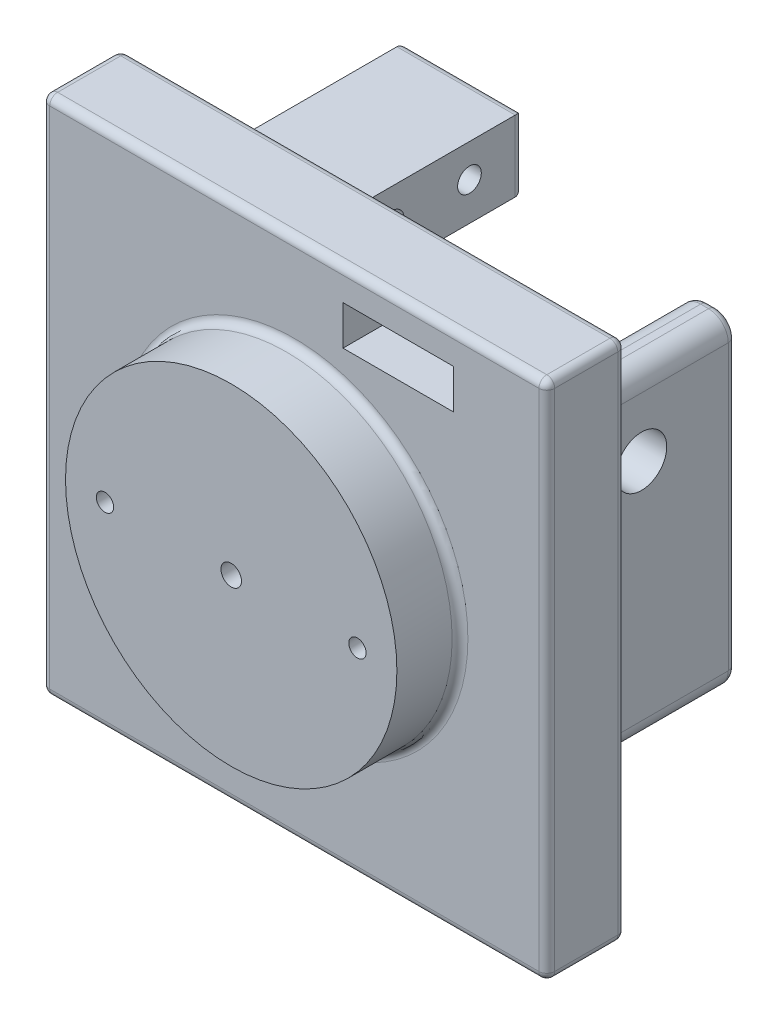
from build123d import *

# Parameters (mm, degrees)
SKETCH1_R               = 21
BOSS_EXTRUDE1_DEPTH     = 8
CUT_EXTRUDE1_DEPTH      = 31.757112998
CUT_EXTRUDE1_DEPTH_BACK = 31.757112998
SKETCH2_R               = 1.3
SKETCH4_R               = 1.1
CUT_EXTRUDE2_DEPTH      = 10
SKETCH5_R               = 1.1
CUT_EXTRUDE3_DEPTH      = 10
SKETCH11_W              = 64
SKETCH11_H              = 66
BOSS_EXTRUDE3_DEPTH     = 10
CUT_EXTRUDE8_START      = -10
SKETCH17_R              = 1.3
CUT_EXTRUDE8_DEPTH      = 10
SKETCH12_W              = 15
SKETCH12_H              = 9
BOSS_EXTRUDE4_DEPTH     = 22
SKETCH13_R              = 1.5
CUT_EXTRUDE4_DEPTH      = 21
SKETCH14_W              = 6
SKETCH14_H              = 41
BOSS_EXTRUDE5_DEPTH     = 22
SKETCH15_R              = 3.2
CUT_EXTRUDE6_DEPTH      = 22
FILLET12_R              = 1
FILLET13_R              = 1
FILLET14_R              = 2.5
SKETCH16_W              = 14
SKETCH16_H              = 5
CUT_EXTRUDE7_DEPTH      = 22
FILLET15_R              = 2.5
SKETCH18_R              = 2.75
CUT_EXTRUDE9_DEPTH      = 3.1


# Some blends are built 0.0001 mm under size
with BuildPart() as part:
    # Sketch1 → Boss-Extrude1 (new body)
    with BuildSketch(Plane.XY):
        Circle(SKETCH1_R)
    extrude(amount=BOSS_EXTRUDE1_DEPTH)

    # Sketch2 → Cut-Extrude1 (cut, two sides: drawn at the far end of the back side and taken through both)
    with BuildSketch(Plane(origin=(0, 0, 0), x_dir=(-1, 0, 0), z_dir=(0, 0, -1)).offset(-CUT_EXTRUDE1_DEPTH_BACK)):
        Circle(SKETCH2_R)
    extrude(amount=CUT_EXTRUDE1_DEPTH + CUT_EXTRUDE1_DEPTH_BACK, mode=Mode.SUBTRACT)

    # Sketch4 → Cut-Extrude2 (cut)
    with BuildSketch(Plane(origin=(0, 0, 0), x_dir=(-1, 0, 0), z_dir=(0, 0, -1))):
        with Locations((16, 0)):
            Circle(SKETCH4_R)
    extrude(amount=-CUT_EXTRUDE2_DEPTH, mode=Mode.SUBTRACT)

    # Sketch5 → Cut-Extrude3 (cut)
    with BuildSketch(Plane(origin=(0, 0, 0), x_dir=(-1, 0, 0), z_dir=(0, 0, -1))):
        with Locations((-16, 0)):
            Circle(SKETCH5_R)
    extrude(amount=-CUT_EXTRUDE3_DEPTH, mode=Mode.SUBTRACT)

    # Sketch11 → Boss-Extrude3 (add)
    with BuildSketch(Plane(origin=(0, 0, 0), x_dir=(-1, 0, 0), z_dir=(0, 0, -1))):
        Rectangle(SKETCH11_W, SKETCH11_H)
    extrude(amount=BOSS_EXTRUDE3_DEPTH)

    # Sketch17 → Cut-Extrude8 (cut)
    with BuildSketch(Plane.XY.offset(CUT_EXTRUDE8_START)):
        with Locations(Location((0, 0, 0), (0, 0, 180))):
            Circle(SKETCH17_R)
    extrude(amount=CUT_EXTRUDE8_DEPTH, mode=Mode.SUBTRACT)

    # Sketch12 → Boss-Extrude4 (add)
    with BuildSketch(Plane(origin=(0, 0, -10), x_dir=(-1, 0, 0), z_dir=(0, 0, -1))):
        with Locations((10.5, -25)):
            Rectangle(SKETCH12_W, SKETCH12_H)
        with Locations((10.5, 25)):
            Rectangle(SKETCH12_W, SKETCH12_H)
    extrude(amount=BOSS_EXTRUDE4_DEPTH)

    # Sketch13 → Cut-Extrude4 (cut)
    with BuildSketch(Plane.ZY.offset(18)):
        with Locations((-25.2, -25.3)):
            Circle(SKETCH13_R)
        with Locations((-15.4, -25.3)):
            Circle(SKETCH13_R)
        with Locations((-25.2, 25.3)):
            Circle(SKETCH13_R)
        with Locations((-15.4, 25.3)):
            Circle(SKETCH13_R)
    extrude(amount=-CUT_EXTRUDE4_DEPTH, mode=Mode.SUBTRACT)

    # Sketch14 → Boss-Extrude5 (add)
    with BuildSketch(Plane(origin=(0, 0, -10), x_dir=(-1, 0, 0), z_dir=(0, 0, -1))):
        with Locations((-21, 0)):
            Rectangle(SKETCH14_W, SKETCH14_H)
    extrude(amount=BOSS_EXTRUDE5_DEPTH)

    # Sketch15 → Cut-Extrude6 (cut)
    with BuildSketch(Plane.ZY.offset(-18)):
        with Locations(Location((-20, 10.5, 0), (0, 0, 270))):
            Circle(SKETCH15_R)
    extrude(amount=-CUT_EXTRUDE6_DEPTH, mode=Mode.SUBTRACT)

    # Fillet12
    fillet12_edges = [part.edges().sort_by_distance(p)[0] for p in [
        (-21, 0, 0),
        (-32, 0, 0),
        (-32, -33, -5),
        (0, 33, 0),
        (-32, 33, -5),
        (32, 0, 0),
        (32, 33, -5),
        (0, -33, 0),
        (32, -33, -5),
        (-32, 0, -10),
        (0, 33, -10),
        (32, 0, -10),
        (0, -33, -10),
    ]]
    fillet(fillet12_edges, radius=FILLET12_R)

    # Fillet13
    fillet13_edges = [part.edges().sort_by_distance(p)[0] for p in [
        (-3, -25, -32),
        (-10.5, -29.5, -32),
        (-18, -25, -32),
        (-10.5, -20.5, -32),
        (-3, 25, -32),
        (-10.5, 20.5, -32),
        (-18, 25, -32),
        (-10.5, 29.5, -32),
        (18, 0, -32),
        (21, 20.5, -32),
        (24, 0, -32),
        (21, -20.5, -32),
    ]]
    fillet(fillet13_edges, radius=FILLET13_R)

    # Fillet14
    # the kernel refuses this fillet: 2.5 mm, written as the material it takes off along each edge
    with BuildSketch(Plane(origin=(21.5, 18, -32), x_dir=(0, 1, 0), z_dir=(-1, 0, 0))) as fillet14_piece_1:
        with BuildLine():
            CenterArc((1.5, -1), 1, 0, 90)
            Line((2.5, -1), (2.5, 0))
            Line((2.5, 0), (1.5, 0))
        make_face()
    revolve(axis=Axis((21.5, 18, -32), (0, 0, -1)), revolution_arc=90, mode=Mode.SUBTRACT)
    with BuildSketch(Plane(origin=(20.5, 18, -32), x_dir=(-1, 0, 0), z_dir=(0, -1, 0))) as fillet14_piece_2:
        with BuildLine():
            CenterArc((1.5, -1), 1, 0, 90)
            Line((2.5, -1), (2.5, 0))
            Line((2.5, 0), (1.5, 0))
        make_face()
    revolve(axis=Axis((20.5, 18, -32), (0, 0, -1)), revolution_arc=90, mode=Mode.SUBTRACT)
    with BuildSketch(Plane(origin=(21.5, -18, -32), x_dir=(1, 0, 0), z_dir=(0, 1, 0))) as fillet14_piece_3:
        with BuildLine():
            CenterArc((1.5, -1), 1, 0, 90)
            Line((2.5, -1), (2.5, 0))
            Line((2.5, 0), (1.5, 0))
        make_face()
    revolve(axis=Axis((21.5, -18, -32), (0, 0, -1)), revolution_arc=90, mode=Mode.SUBTRACT)
    with BuildSketch(Plane(origin=(20.5, -18, -32), x_dir=(0, -1, 0), z_dir=(1, 0, 0))) as fillet14_piece_4:
        with BuildLine():
            CenterArc((1.5, -1), 1, 0, 90)
            Line((2.5, -1), (2.5, 0))
            Line((2.5, 0), (1.5, 0))
        make_face()
    revolve(axis=Axis((20.5, -18, -32), (0, 0, -1)), revolution_arc=90, mode=Mode.SUBTRACT)
    with BuildSketch(Plane(origin=(18, -20.5, -10), x_dir=(0, 1, 0), z_dir=(0, 0, -1)), Plane(origin=(24, -20.5, -10), x_dir=(-1, 0, 0), z_dir=(0, 0, -1)), Plane(origin=(18, 20.5, -10), x_dir=(1, 0, 0), z_dir=(0, 0, -1))) as fillet14_piece_5:
        with BuildLine():
            CenterArc((FILLET14_R, FILLET14_R), FILLET14_R, 180, 90)
            Line((0, FILLET14_R), (0, 0))
            Line((0, 0), (FILLET14_R, 0))
        make_face()
    extrude(amount=22, mode=Mode.SUBTRACT)
    with BuildSketch(Plane(origin=(24, 20.5, -10), x_dir=(-1, 0, 0), z_dir=(0, 0, -1))) as fillet14_piece_6:
        with BuildLine():
            CenterArc((FILLET14_R, -FILLET14_R), FILLET14_R, 90, 90)
            Line((0, -FILLET14_R), (0, 0))
            Line((0, 0), (FILLET14_R, 0))
        make_face()
    extrude(amount=22, mode=Mode.SUBTRACT)
    # the kernel refuses this fillet: 2.5 mm, written as the material it adds along each edge
    with BuildSketch(Plane(origin=(18, 18, -10), x_dir=(-1, 0, 0), z_dir=(0, -1, 0)), Plane(origin=(24, -18, -10), x_dir=(1, 0, 0), z_dir=(0, 1, 0))) as fillet14_2_piece_1:
        with BuildLine():
            CenterArc((FILLET14_R, FILLET14_R), FILLET14_R, 180, 90)
            Line((0, FILLET14_R), (0, 0))
            Line((0, 0), (FILLET14_R, 0))
        make_face()
    extrude(amount=36)
    with BuildSketch(Plane(origin=(21.5, 20.5, -10), x_dir=(0, 1, 0), z_dir=(-1, 0, 0)), Plane(origin=(20.5, -20.5, -10), x_dir=(0, -1, 0), z_dir=(1, 0, 0))) as fillet14_2_piece_2:
        with BuildLine():
            CenterArc((FILLET14_R, FILLET14_R), FILLET14_R, 180, 90)
            Line((0, FILLET14_R), (0, 0))
            Line((0, 0), (FILLET14_R, 0))
        make_face()
    extrude(amount=1)
    with BuildSketch(Plane(origin=(20.5, -18, -10), x_dir=(-1, 0, 0), z_dir=(0, 1, 0))) as fillet14_2_piece_3:
        with BuildLine():
            CenterArc((2.5 + FILLET14_R, -FILLET14_R), FILLET14_R, 90, 90)
            Line((2.5, -FILLET14_R), (2.5, 0))
            Line((2.5, 0), (2.5 + FILLET14_R, 0))
        make_face()
    revolve(axis=Axis((20.5, -18, -10), (0, 0, 1)), revolution_arc=90)
    with BuildSketch(Plane(origin=(21.5, -18, -10), x_dir=(0, -1, 0), z_dir=(-1, 0, 0))) as fillet14_2_piece_4:
        with BuildLine():
            CenterArc((2.5 + FILLET14_R, -FILLET14_R), FILLET14_R, 90, 90)
            Line((2.5, -FILLET14_R), (2.5, 0))
            Line((2.5, 0), (2.5 + FILLET14_R, 0))
        make_face()
    revolve(axis=Axis((21.5, -18, -10), (0, 0, 1)), revolution_arc=90)
    with BuildSketch(Plane(origin=(21.5, 18, -10), x_dir=(0, 1, 0), z_dir=(-1, 0, 0))) as fillet14_2_piece_5:
        with BuildLine():
            CenterArc((2.5 + FILLET14_R, FILLET14_R), FILLET14_R, 180, 90)
            Line((2.5, FILLET14_R), (2.5, 0))
            Line((2.5, 0), (2.5 + FILLET14_R, 0))
        make_face()
    revolve(axis=Axis((21.5, 18, -10), (0, 0, -1)), revolution_arc=90)
    with BuildSketch(Plane(origin=(20.5, 18, -10), x_dir=(0, 1, 0), z_dir=(1, 0, 0))) as fillet14_2_piece_6:
        with BuildLine():
            CenterArc((2.5 + FILLET14_R, -FILLET14_R), FILLET14_R, 90, 90)
            Line((2.5, -FILLET14_R), (2.5, 0))
            Line((2.5, 0), (2.5 + FILLET14_R, 0))
        make_face()
    revolve(axis=Axis((20.5, 18, -10), (0, 0, 1)), revolution_arc=90)

    # Sketch16 → Cut-Extrude7 (cut)
    with BuildSketch(Plane(origin=(0, 0, -10), x_dir=(-1, 0, 0), z_dir=(0, 0, -1))):
        with Locations((-13.170947401, 26.5)):
            Rectangle(SKETCH16_W, SKETCH16_H)
    extrude(amount=-CUT_EXTRUDE7_DEPTH, mode=Mode.SUBTRACT)

    # Fillet15
    fillet15_edges = [part.edges().sort_by_distance(p)[0] for p in [
        (-3, -25, -10),
        (-10.5, -29.5, -10),
        (-18, -25, -10),
        (-3, 25, -10),
        (-18, 25, -10),
        (-10.5, 29.5, -10),
    ]]
    fillet(fillet15_edges, radius=FILLET15_R - 0.0001)  # a hair under: the kernel refuses the full size

    # Sketch18 → Cut-Extrude9 (cut)
    with BuildSketch(Plane(origin=(0, 0, -10), x_dir=(-1, 0, 0), z_dir=(0, 0, -1))):
        Circle(SKETCH18_R)
    extrude(amount=-CUT_EXTRUDE9_DEPTH, mode=Mode.SUBTRACT)


solid = part.part
